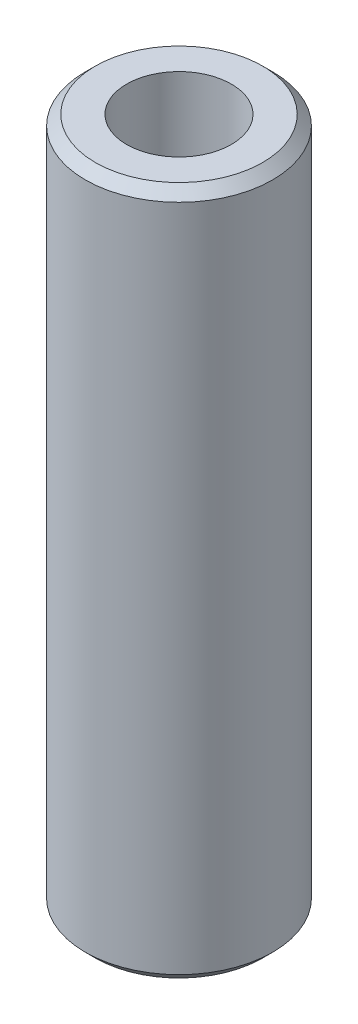
from build123d import *

# Parameters (mm, degrees)
SKETCH1_R           = 45
BOSS_EXTRUDE1_DEPTH = 331.012194232
SKETCH2_R           = 25.161923872
CUT_EXTRUDE1_DEPTH  = 338.074283697
CHAMFER1_SIZE       = 4.814780146


with BuildPart() as part:
    # Sketch1 → Boss-Extrude1 (new body)
    with BuildSketch(Plane(origin=(0, 0, 0), x_dir=(1, 0, 0), z_dir=(0, 1, 0))):
        Circle(SKETCH1_R)
    extrude(amount=BOSS_EXTRUDE1_DEPTH)

    # Sketch2 → Cut-Extrude1 (cut, through all)
    with BuildSketch(Plane(origin=(0, 0, 0), x_dir=(1, 0, 0), z_dir=(0, 1, 0))):
        Circle(SKETCH2_R)
    extrude(amount=CUT_EXTRUDE1_DEPTH, mode=Mode.SUBTRACT)

    # Chamfer1
    chamfer1_edges = [part.edges().sort_by_distance(p)[0] for p in [
        (-45, 331.012194232, 0),
        (-45, 0, 0),
    ]]
    chamfer(chamfer1_edges, length=CHAMFER1_SIZE)


solid = part.part
